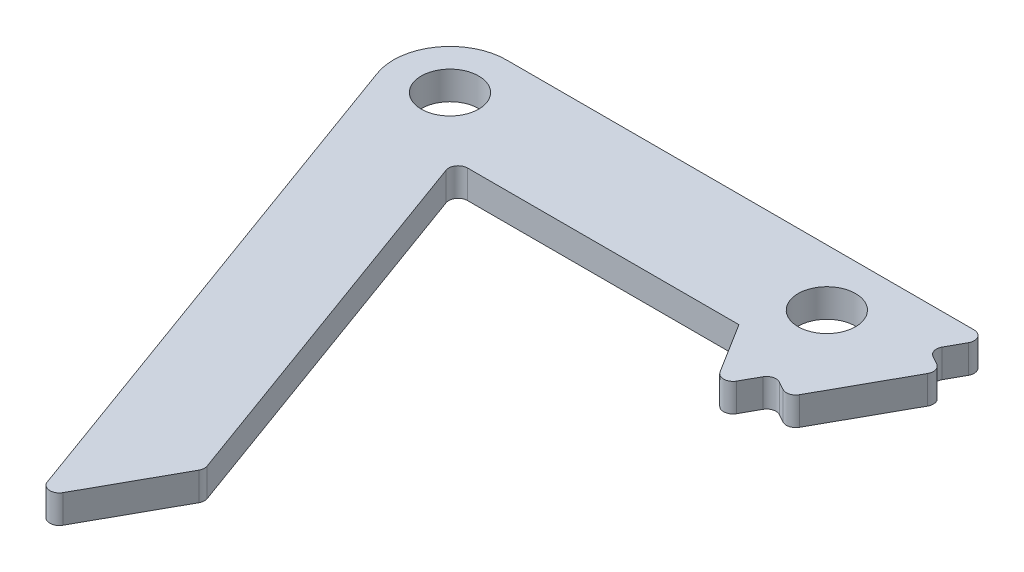
from build123d import *

# Parameters (mm, degrees)
SKETCH1_R           = 3.05
BOSS_EXTRUDE1_DEPTH = 3
BOSS_EXTRUDE2_DEPTH = 3
FILLET1_R           = 1


# Read off the part's stored shape, not the designer's step: Boss-Extrude2
with BuildPart() as part:
    # Sketch1 → Boss-Extrude1 (new body)
    with BuildSketch(Plane(origin=(0, 0, 0), x_dir=(1, 0, 0), z_dir=(0, 1, 0))):
        with BuildLine():
            Line((0, 6), (40, 6))
            Line((40, 6), (51.329332784, 6))
            Line((51.329332784, 6), (49.031195671, 1.854050901))
            Line((49.031195671, 1.854050901), (51.655054793, 0.39962204))
            Line((51.655054793, 0.39962204), (45.83733935, -10.095814445))
            Line((45.83733935, -10.095814445), (43.213480228, -8.641385585))
            Line((43.213480228, -8.641385585), (40.915343116, -12.787334683))
            Line((40.915343116, -12.787334683), (36.674145691, -6))
            Line((36.674145691, -6), (0, -6))
            ThreePointArc((0, -6), (-6, 0), (0, 6))
        make_face()
        with Locations(Location((0, 0, 0), (0, 0, 270))):
            Circle(SKETCH1_R, mode=Mode.SUBTRACT)
        with Locations(Location((40, 0, 0), (0, 0, 270))):
            Circle(SKETCH1_R, mode=Mode.SUBTRACT)
    extrude(amount=BOSS_EXTRUDE1_DEPTH)

    # Boss-Extrude2 outline → Boss-Extrude2 (add)
    with BuildSketch(Plane(origin=(0, 0, 0), x_dir=(1, 0, 0), z_dir=(0, 1, 0))):
        with BuildLine():
            Line((15.172439685, -59.228761833), (21.596230146, -47.639937071))
            Line((21.596230146, -47.639937071), (6.440532496, -6))
            Line((6.440532496, -6), (0, -6))
            ThreePointArc((0, -6), (-3.441458618, -4.914912266), (-5.638155725, -2.05212086))
            Line((-5.638155725, -2.05212086), (15.172439685, -59.228761833))
        make_face()
    extrude(amount=BOSS_EXTRUDE2_DEPTH)

    # Fillet1
    fillet1_edges = [part.edges().sort_by_distance(p)[0] for p in [
        (51.329332784, 1.5, -6),
        (49.031195671, 1.5, -1.854050901),
        (51.655054793, 1.5, -0.39962204),
        (45.83733935, 1.5, 10.095814445),
        (43.213480228, 1.5, 8.641385585),
        (40.915343116, 1.5, 12.787334683),
        (6.440532496, 1.5, 6),
        (21.596230146, 1.5, 47.639937071),
        (15.172439685, 1.5, 59.228761833),
    ]]
    fillet(fillet1_edges, radius=FILLET1_R)


solid = part.part
